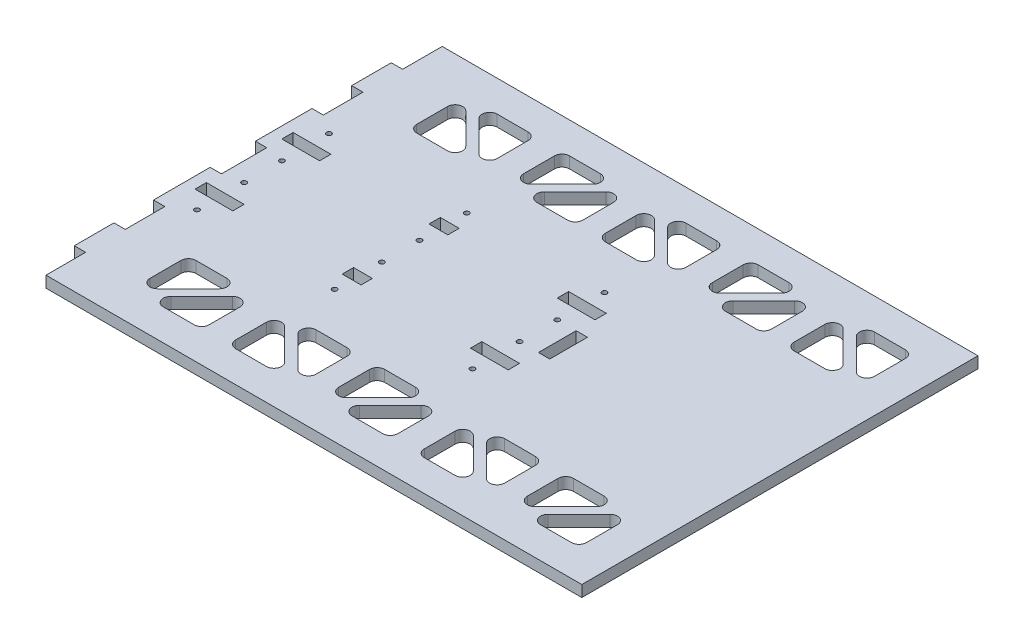
from build123d import *

# Parameters (mm, degrees)
SKETCH1_W            = 290
SKETCH1_H            = 210
BOSS_EXTRUDE1_DEPTH  = 6
SKETCH2_W            = 6
SKETCH2_H            = 21
CUT_EXTRUDE1_DEPTH   = 180.125654221
SKETCH3_W            = 20
SKETCH3_H            = 6
SKETCH3_W_2          = 10
CUT_EXTRUDE2_DEPTH   = 180.125654221
SKETCH4_W            = 6
SKETCH4_H            = 20
CUT_EXTRUDE3_DEPTH   = 180.125654221
SKETCH6_R            = 1.3
CUT_EXTRUDE4_DEPTH   = 180.125654221
CUT_EXTRUDE5_DEPTH   = 180.125654221
FILLET1_R            = 4
FILLET1_OF_MIRROR1_R = 4
SKETCH8_R            = 1.3
CUT_EXTRUDE6_DEPTH   = 180.125654221


with BuildPart() as part:
    # Sketch1 → Boss-Extrude1 (new body)
    with BuildSketch(Plane(origin=(0, 0, 0), x_dir=(1, 0, 0), z_dir=(0, 1, 0))):
        Rectangle(SKETCH1_W, SKETCH1_H)
    extrude(amount=BOSS_EXTRUDE1_DEPTH)

    # Sketch2 → Cut-Extrude1 (cut, through all)
    with BuildSketch(Plane(origin=(0, 6, 0), x_dir=(1, 0, 0), z_dir=(0, 1, 0))):
        with Locations((-142, 94.5)):
            Rectangle(SKETCH2_W, SKETCH2_H)
        Polygon((-145, -12), (-145, 0), (-145, 12), (-139, 12), (-139, -12), align=None)
        with Locations((-142, 52.5)):
            Rectangle(SKETCH2_W, SKETCH2_H)
        with Locations((-142, -52.5)):
            Rectangle(SKETCH2_W, SKETCH2_H)
        with Locations((-142, -94.5)):
            Rectangle(SKETCH2_W, SKETCH2_H)
    extrude(amount=-CUT_EXTRUDE1_DEPTH, mode=Mode.SUBTRACT)

    # Sketch3 → Cut-Extrude2 (cut, through all)
    with BuildSketch(Plane(origin=(0, 6, 0), x_dir=(1, 0, 0), z_dir=(0, 1, 0))):
        with Locations((-129, 23)):
            Rectangle(SKETCH3_W, SKETCH3_H)
        with Locations((-56, 23)):
            Rectangle(SKETCH3_W_2, SKETCH3_H)
        with Locations((17, 23)):
            Rectangle(SKETCH3_W, SKETCH3_H)
        with Locations((17, -23)):
            Rectangle(SKETCH3_W, SKETCH3_H)
        with Locations((-56, -23)):
            Rectangle(SKETCH3_W_2, SKETCH3_H)
        with Locations((-129, -23)):
            Rectangle(SKETCH3_W, SKETCH3_H)
    extrude(amount=-CUT_EXTRUDE2_DEPTH, mode=Mode.SUBTRACT)

    # Sketch4 → Cut-Extrude3 (cut, through all)
    with BuildSketch(Plane(origin=(0, 6, 0), x_dir=(1, 0, 0), z_dir=(0, 1, 0))):
        with Locations((30, 0)):
            Rectangle(SKETCH4_W, SKETCH4_H)
    extrude(amount=-CUT_EXTRUDE3_DEPTH, mode=Mode.SUBTRACT)

    # Sketch6 → Cut-Extrude4 (cut, through all)
    with BuildSketch(Plane(origin=(0, 6, 0), x_dir=(1, 0, 0), z_dir=(0, 1, 0))):
        with Locations((-129, 35)):
            Circle(SKETCH6_R)
        with Locations((-56, 35)):
            Circle(SKETCH6_R)
        with Locations((17, 35)):
            Circle(SKETCH6_R)
        with Locations((17, -35)):
            Circle(SKETCH6_R)
        with Locations((-56, -35)):
            Circle(SKETCH6_R)
        with Locations((-129, -35)):
            Circle(SKETCH6_R)
    extrude(amount=-CUT_EXTRUDE4_DEPTH, mode=Mode.SUBTRACT)

    # Sketch7 → Cut-Extrude5 (cut, through all)
    with BuildSketch(Plane(origin=(0, 6, 0), x_dir=(1, 0, 0), z_dir=(0, 1, 0))):
        Polygon((-110, 88.5), (-110, 58.5), (-80, 58.5), align=None)
        Polygon((-103, 88.5), (-73, 58.5), (-73, 88.5), align=None)
        Polygon((-59, 88.5), (-29, 88.5), (-59, 58.5), align=None)
        Polygon((-22, 58.5), (-52, 58.5), (-22, 88.5), align=None)
        Polygon((-10, 88.5), (-10, 58.5), (20, 58.5), align=None)
        Polygon((-3, 88.5), (27, 58.5), (27, 88.5), align=None)
        Polygon((41, 88.5), (71, 88.5), (41, 58.5), align=None)
        Polygon((78, 58.5), (48, 58.5), (78, 88.5), align=None)
        Polygon((90, 88.5), (90, 58.5), (120, 58.5), align=None)
        Polygon((97, 88.5), (127, 58.5), (127, 88.5), align=None)
    cut_extrude5 = extrude(amount=-CUT_EXTRUDE5_DEPTH, mode=Mode.SUBTRACT)

    # Fillet1
    fillet1_edges = [part.edges().sort_by_distance(p)[0] for p in [
        (97, 3, -88.5),
        (127, 3, -88.5),
        (127, 3, -58.5),
        (120, 3, -58.5),
        (90, 3, -88.5),
        (90, 3, -58.5),
        (78, 3, -58.5),
        (78, 3, -88.5),
        (48, 3, -58.5),
        (41, 3, -58.5),
        (71, 3, -88.5),
        (41, 3, -88.5),
        (-3, 3, -88.5),
        (27, 3, -88.5),
        (27, 3, -58.5),
        (-10, 3, -58.5),
        (20, 3, -58.5),
        (-10, 3, -88.5),
        (-52, 3, -58.5),
        (-22, 3, -58.5),
        (-22, 3, -88.5),
        (-29, 3, -88.5),
        (-59, 3, -88.5),
        (-59, 3, -58.5),
        (-73, 3, -58.5),
        (-73, 3, -88.5),
        (-103, 3, -88.5),
        (-110, 3, -58.5),
        (-80, 3, -58.5),
        (-110, 3, -88.5),
    ]]
    fillet(fillet1_edges, radius=FILLET1_R)

    # Mirror1: Cut-Extrude5 across plane
    add(cut_extrude5.mirror(Plane.XY), mode=Mode.SUBTRACT)

    # Fillet1 of Mirror1
    fillet1_of_mirror1_edges = [part.edges().sort_by_distance(p)[0] for p in [
        (97, 3, 88.5),
        (127, 3, 88.5),
        (127, 3, 58.5),
        (120, 3, 58.5),
        (90, 3, 88.5),
        (90, 3, 58.5),
        (78, 3, 58.5),
        (78, 3, 88.5),
        (48, 3, 58.5),
        (41, 3, 58.5),
        (71, 3, 88.5),
        (41, 3, 88.5),
        (-3, 3, 88.5),
        (27, 3, 88.5),
        (27, 3, 58.5),
        (-10, 3, 58.5),
        (20, 3, 58.5),
        (-10, 3, 88.5),
        (-52, 3, 58.5),
        (-22, 3, 58.5),
        (-22, 3, 88.5),
        (-29, 3, 88.5),
        (-59, 3, 88.5),
        (-59, 3, 58.5),
        (-73, 3, 58.5),
        (-73, 3, 88.5),
        (-103, 3, 88.5),
        (-110, 3, 58.5),
        (-80, 3, 58.5),
        (-110, 3, 88.5),
    ]]
    fillet(fillet1_of_mirror1_edges, radius=FILLET1_OF_MIRROR1_R)

    # Sketch8 → Cut-Extrude6 (cut, through all)
    with BuildSketch(Plane(origin=(0, 6, 0), x_dir=(1, 0, 0), z_dir=(0, 1, 0))):
        with Locations((-129, -10)):
            Circle(SKETCH8_R)
        with Locations((-56, -10)):
            Circle(SKETCH8_R)
        with Locations((17, -10)):
            Circle(SKETCH8_R)
        with Locations((-129, 10)):
            Circle(SKETCH8_R)
        with Locations((-56, 10)):
            Circle(SKETCH8_R)
        with Locations((17, 10)):
            Circle(SKETCH8_R)
    extrude(amount=-CUT_EXTRUDE6_DEPTH, mode=Mode.SUBTRACT)


solid = part.part
